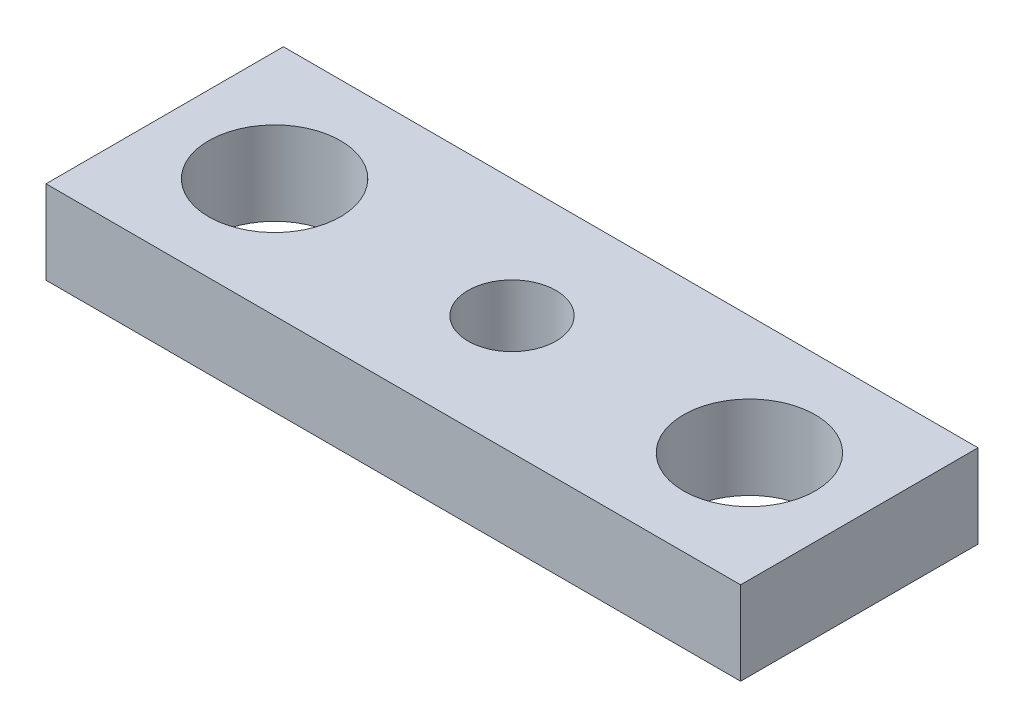
from build123d import *

# Parameters (mm, degrees)
SKETCH_1_W          = 79
SKETCH_1_H          = 27
EXTRUDE_1_DEPTH     = 9.5
SKETCH_3_R          = 7.5
CUT_EXTRUDE_1_DEPTH = 43.810629521
SKETCH_10_R         = 5
CUT_EXTRUDE_2_DEPTH = 43.810629521


with BuildPart() as part:
    # 草图1 → 凸台-拉伸1 (new body)
    with BuildSketch(Plane(origin=(0, 0, 0), x_dir=(1, 0, 0), z_dir=(0, 1, 0))):
        Rectangle(SKETCH_1_W, SKETCH_1_H)
    extrude(amount=EXTRUDE_1_DEPTH)

    # 草图3 → 切除-拉伸1 (cut, through all)
    with BuildSketch(Plane(origin=(0, 9.5, 0), x_dir=(1, 0, 0), z_dir=(0, 1, 0))):
        with Locations((-27, 0)):
            Circle(SKETCH_3_R)
        with Locations((27, 0)):
            Circle(SKETCH_3_R)
    extrude(amount=-CUT_EXTRUDE_1_DEPTH, mode=Mode.SUBTRACT)

    # 草图10 → 切除-拉伸2 (cut, through all)
    with BuildSketch(Plane.XZ):
        Circle(SKETCH_10_R)
    extrude(amount=-CUT_EXTRUDE_2_DEPTH, mode=Mode.SUBTRACT)


solid = part.part
